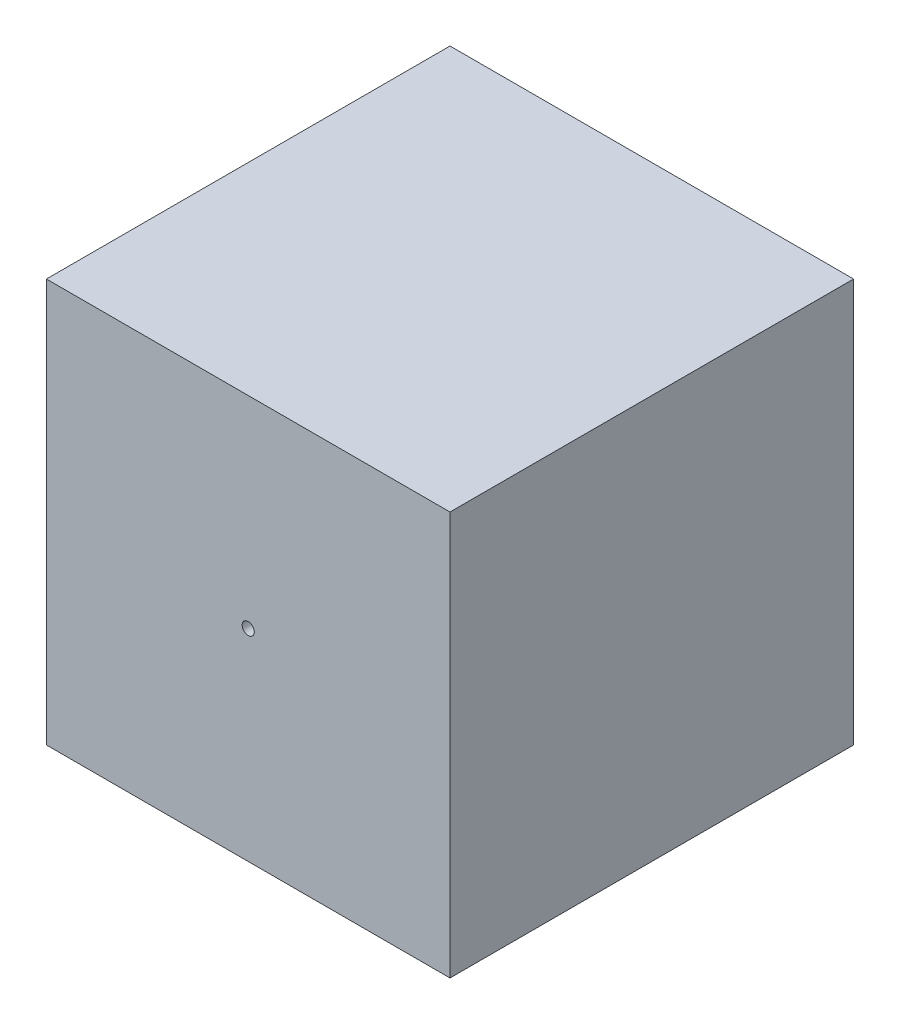
from build123d import *

# Parameters (mm, degrees)
CROQUIS1_W              = 100
CROQUIS1_H              = 100
SALIENTE_EXTRUIR1_DEPTH = 100
CROQUIS2_R              = 1.5
CORTAR_EXTRUIR1_DEPTH   = 123.474487139


with BuildPart() as part:
    # Croquis1 → Saliente-Extruir1 (new body)
    with BuildSketch(Plane.XY):
        Rectangle(CROQUIS1_W, CROQUIS1_H)
    extrude(amount=SALIENTE_EXTRUIR1_DEPTH)

    # Croquis2 → Cortar-Extruir1 (cut, through all)
    with BuildSketch(Plane.XY.offset(100)):
        Circle(CROQUIS2_R)
    extrude(amount=-CORTAR_EXTRUIR1_DEPTH, mode=Mode.SUBTRACT)


solid = part.part
